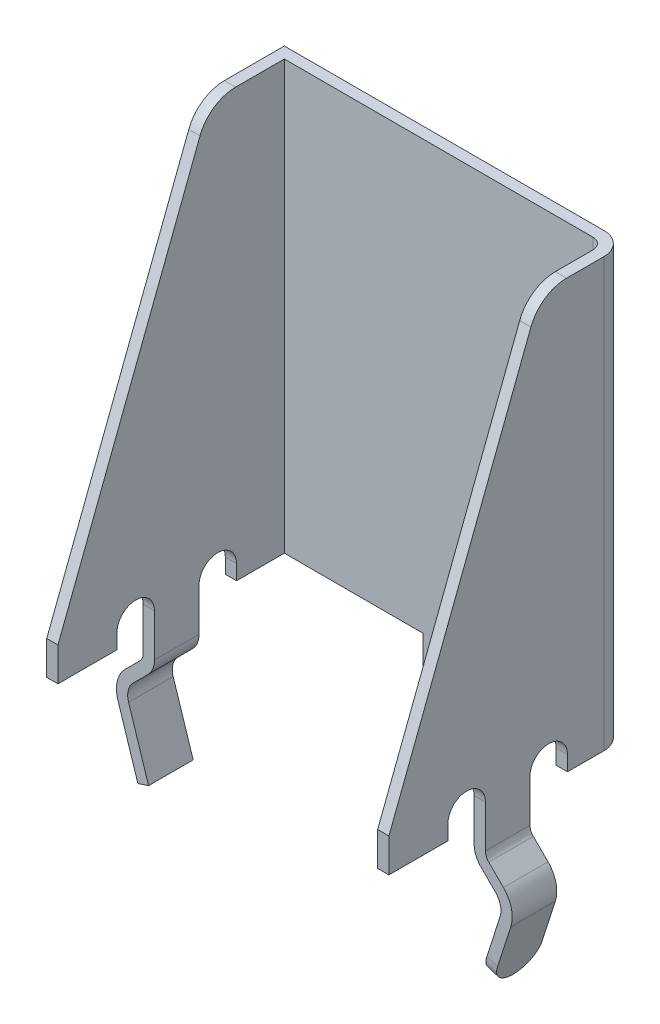
from build123d import *

# Parameters (mm, degrees)
SKETCH1_W                       = 9.13
SKETCH1_H                       = 0.3
BOSS_EXTRUDE1_DEPTH             = 11.42
BOSS_EXTRUDE3_DEPTH             = 0.3
BOSS_EXTRUDE4_DEPTH             = 0.3
FILLET2_R                       = 0.3
FILLET3_R                       = 0.6
BOSS_EXTRUDE5_REACH             = 14.701
BOSS_EXTRUDE5_DIRECTION_2_REACH = 14.701
FILLET4_R                       = 0.595


with BuildPart() as part:
    # Sketch1 → Boss-Extrude1 (new body)
    with BuildSketch(Plane(origin=(0, 0, 0), x_dir=(1, 0, 0), z_dir=(0, 1, 0))):
        Rectangle(SKETCH1_W, SKETCH1_H)
    extrude(amount=BOSS_EXTRUDE1_DEPTH)

    # Sketch3 → Boss-Extrude3 (add)
    with BuildSketch(Plane(origin=(0, 0, -0.15), x_dir=(-1, 0, 0), z_dir=(0, 0, -1))):
        with BuildLine():
            Line((-0.57, 0), (0.57, 0))
            Line((0.57, 0), (0.57, -1.6))
            Line((0.57, -1.6), (0.33, -2.770784784))
            ThreePointArc((0.33, -2.770784784), (0, -3.04), (-0.33, -2.770784784))
            Line((-0.33, -2.770784784), (-0.57, -1.6))
            Line((-0.57, -1.6), (-0.57, 0))
        make_face()
    extrude(amount=-BOSS_EXTRUDE3_DEPTH)

    # Sketch4 → Boss-Extrude4 (add)
    with BuildSketch(Plane(origin=(4.565, 0, 0), x_dir=(0, 0, -1), z_dir=(1, 0, 0))):
        with BuildLine():
            Line((-0.15, 11.42), (-0.15, 0))
            Line((-0.15, 0), (-1.425, 0))
            Line((-1.425, 0), (-1.425, 0.4))
            ThreePointArc((-1.425, 0.4), (-1.925, 0.9), (-2.425, 0.4))
            Line((-2.425, 0.4), (-2.425, 0))
            Line((-2.425, 0), (-3.615, 0))
            Line((-3.615, 0), (-3.615, 0.4))
            ThreePointArc((-3.615, 0.4), (-4.115, 0.9), (-4.615, 0.4))
            Line((-4.615, 0.4), (-4.615, 0))
            Line((-4.615, 0), (-6.19, 0))
            Line((-6.19, 0), (-6.19, 0.9))
            Line((-6.19, 0.9), (-2.4, 10.767226789))
            ThreePointArc((-2.4, 10.767226789), (-2.026327352, 11.241078061), (-1.45, 11.42))
            Line((-1.45, 11.42), (-0.15, 11.42))
        make_face()
    boss_extrude4 = extrude(amount=-BOSS_EXTRUDE4_DEPTH)

    # Fillet2
    fillet2_edges = [part.edges().sort_by_distance(p)[0] for p in [
        (4.265, 5.71, 0.15),
    ]]
    fillet(fillet2_edges, radius=FILLET2_R)

    # Fillet3
    fillet3_edges = [part.edges().sort_by_distance(p)[0] for p in [
        (4.565, 5.71, -0.15),
    ]]
    fillet(fillet3_edges, radius=FILLET3_R)

    # Boss-Extrude5: up to this face of the body (flat: up to its plane)
    boss_extrude5_end = Plane(part.part.faces().sort_by_distance((4.415, 0.2, 2.425))[0])
    # Sketch5 → Boss-Extrude5 (add, up to the picked face)
    with BuildSketch(Plane(origin=(0, 0, 3.02), x_dir=(-1, 0, 0), z_dir=(0, 0, -1)), mode=Mode.PRIVATE) as boss_extrude5_sk1:
        with BuildLine():
            Line((-4.565, 0), (-4.265, 0))
            Line((-4.265, 0), (-4.265, -0.734365081))
            ThreePointArc((-4.265, -0.734365081), (-4.31067228, -0.963975141), (-4.440735931, -1.15862915))
            Line((-4.440735931, -1.15862915), (-4.833553391, -1.551446609))
            ThreePointArc((-4.833553391, -1.551446609), (-4.966005966, -1.787534255), (-4.95599841, -2.058053958))
            Line((-4.95599841, -2.058053958), (-4.422200477, -3.718167625))
            Line((-4.422200477, -3.718167625), (-4.707799523, -3.81))
            Line((-4.707799523, -3.81), (-5.241597456, -2.149886332))
            ThreePointArc((-5.241597456, -2.149886332), (-5.257609545, -1.717054807), (-5.045685425, -1.339314575))
            Line((-5.045685425, -1.339314575), (-4.652867966, -0.946497116))
            ThreePointArc((-4.652867966, -0.946497116), (-4.58783614, -0.849170111), (-4.565, -0.734365081))
            Line((-4.565, -0.734365081), (-4.565, 0))
        make_face()
    boss_extrude5_tool1 = split(extrude(boss_extrude5_sk1.sketch, amount=BOSS_EXTRUDE5_REACH, mode=Mode.PRIVATE), bisect_by=boss_extrude5_end, keep=Keep.BOTH, mode=Mode.PRIVATE)
    boss_extrude5 = boss_extrude5_tool1.solids().sort_by(Axis((4.415, -0.039429, 3.02), (0, 0, -1)))[0]
    add(boss_extrude5)

    # Boss-Extrude5 direction 2: up to this face of the body (flat: up to its plane)
    boss_extrude5_direction_2_end = Plane(part.part.faces().sort_by_distance((4.415, 0.2, 3.615))[0])
    # Sketch5 → Boss-Extrude5 direction 2 (add, up to the picked face)
    with BuildSketch(Plane(origin=(0, 0, 3.02), x_dir=(-1, 0, 0), z_dir=(0, 0, -1)), mode=Mode.PRIVATE) as boss_extrude5_direction_2_sk1:
        with BuildLine():
            Line((-4.565, 0), (-4.265, 0))
            Line((-4.265, 0), (-4.265, -0.734365081))
            ThreePointArc((-4.265, -0.734365081), (-4.31067228, -0.963975141), (-4.440735931, -1.15862915))
            Line((-4.440735931, -1.15862915), (-4.833553391, -1.551446609))
            ThreePointArc((-4.833553391, -1.551446609), (-4.966005966, -1.787534255), (-4.95599841, -2.058053958))
            Line((-4.95599841, -2.058053958), (-4.422200477, -3.718167625))
            Line((-4.422200477, -3.718167625), (-4.707799523, -3.81))
            Line((-4.707799523, -3.81), (-5.241597456, -2.149886332))
            ThreePointArc((-5.241597456, -2.149886332), (-5.257609545, -1.717054807), (-5.045685425, -1.339314575))
            Line((-5.045685425, -1.339314575), (-4.652867966, -0.946497116))
            ThreePointArc((-4.652867966, -0.946497116), (-4.58783614, -0.849170111), (-4.565, -0.734365081))
            Line((-4.565, -0.734365081), (-4.565, 0))
        make_face()
    boss_extrude5_direction_2_tool1 = split(extrude(boss_extrude5_direction_2_sk1.sketch, amount=-BOSS_EXTRUDE5_DIRECTION_2_REACH, mode=Mode.PRIVATE), bisect_by=boss_extrude5_direction_2_end, keep=Keep.BOTH, mode=Mode.PRIVATE)
    boss_extrude5_direction_2 = boss_extrude5_direction_2_tool1.solids().sort_by(Axis((4.415, -0.039429, 3.02), (0, 0, 1)))[0]
    add(boss_extrude5_direction_2)

    # Fillet4
    fillet4_edges = [part.edges().sort_by_distance(p)[0] for p in [
        (4.565, -3.764083813, 2.425),
        (4.565, -3.764083813, 3.615),
    ]]
    fillet(fillet4_edges, radius=FILLET4_R - 0.0001)  # a hair under: the kernel refuses the full size

    # Mirror1: Boss-Extrude4, Boss-Extrude5, Boss-Extrude5 direction 2 across plane
    add(boss_extrude4.mirror(Plane(origin=(0, 0, 0), x_dir=(0, 0, 1), z_dir=(1, 0, 0))))
    add(boss_extrude5.mirror(Plane(origin=(0, 0, 0), x_dir=(0, 0, 1), z_dir=(1, 0, 0))))
    add(boss_extrude5_direction_2.mirror(Plane(origin=(0, 0, 0), x_dir=(0, 0, 1), z_dir=(1, 0, 0))))

    # Sketch7 → Revolve2 (revolve)
    with BuildSketch(Plane(origin=(0, 0, 0), x_dir=(0, 0, -1), z_dir=(1, 0, 0)), mode=Mode.PRIVATE) as revolve2_sk:
        with BuildLine():
            Line((0.15, 9.21), (0.436483674, 9.474099927))
            ThreePointArc((0.436483674, 9.474099927), (0.53, 9.6875), (0.436483674, 9.900900073))
            Line((0.436483674, 9.900900073), (0.15, 10.165))
            Line((0.15, 10.165), (0.15, 9.21))
        make_face()
    revolve(revolve2_sk.sketch.rotate(Axis((0, 6.99, -0.15), (0, 0, -1)), 90), axis=Axis((0, 6.99, -0.15), (0, 0, -1)))


solid = part.part
